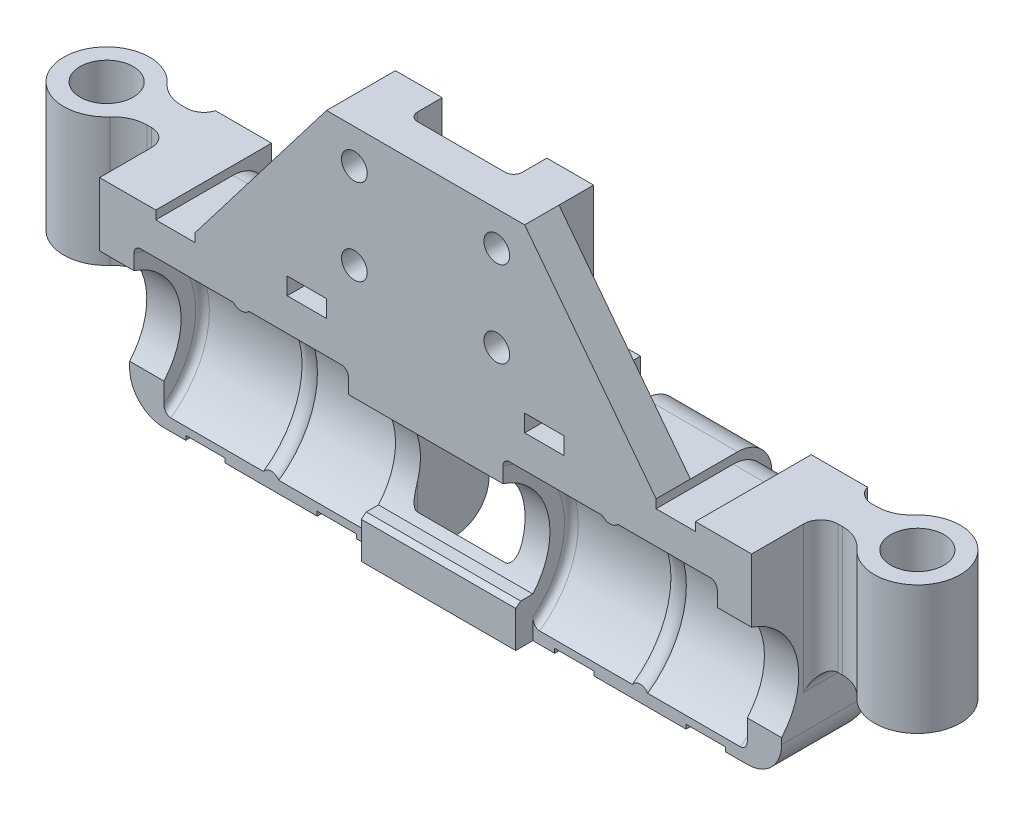
from build123d import *

# Parameters (mm, degrees)
BOSS_EXTRUDE1_DEPTH = 38
CUT_EXTRUDE1_DEPTH  = 38
SKETCH11_W          = 4.582575694955825
SKETCH11_H          = 0.9999999999999964
SKETCH11_W_2        = 4.582575694955834
CUT_EXTRUDE2_DEPTH  = 30
SKETCH13_W          = 4.582575694955825
SKETCH13_H          = 0.9999999999999964
SKETCH13_W_2        = 4.582575694955834
CUT_EXTRUDE3_DEPTH  = 30
FILLET1_R           = 4
CUT_EXTRUDE4_DEPTH  = 40
BOSS_EXTRUDE2_DEPTH = 20
BOSS_EXTRUDE4_DEPTH = 3.9999999999999964
FILLET3_R           = 4
SKETCH19_W          = 18.000000000000004
SKETCH19_H          = 4.708497377870816
BOSS_EXTRUDE5_DEPTH = 2
SKETCH20_R          = 7
CUT_EXTRUDE5_DEPTH  = 11
SKETCH22_R          = 3.1000000000000165
BOSS_EXTRUDE6_DEPTH = 15
FILLET4_R           = 2
SKETCH23_R          = 1.5
CUT_EXTRUDE6_DEPTH  = 10


with BuildPart() as part:
    # Sketch5 → Boss-Extrude1 (new body)
    with BuildSketch(Plane(origin=(0, 0, 0), x_dir=(0, 0, -1), z_dir=(1, 0, 0))):
        with BuildLine():
            Line((2.5000000000000004, 18.500000000000007), (16, 18.500000000000007))
            Line((16, 18.500000000000007), (16, -10))
            Line((16, -10), (5.999999999999997, -10))
            Line((5.999999999999997, -10), (5.9999999999999964, -5.291502622129185))
            ThreePointArc((5.9999999999999964, -5.291502622129185), (7.7204902216687685, 2.096194346218137), (2.5000000000000004, 7.59934207678533))
            Line((2.5000000000000004, 7.59934207678533), (2.5000000000000004, 18.500000000000007))
        make_face()
    extrude(amount=BOSS_EXTRUDE1_DEPTH)

    # Sketch2 → Cut-Revolve1 (revolve, cut)
    with BuildSketch(Plane.XY):
        with BuildLine():
            Line((22.394427190999902, 10.500000000000009), (33.19999999999998, 10.500000000000012))
            ThreePointArc((33.19999999999998, 10.500000000000012), (33.765685424949226, 10.265685424949249), (33.999999999999986, 9.700000000000005))
            Line((33.999999999999986, 9.700000000000005), (33.999999999999986, 0))
            Line((33.999999999999986, 0), (9, 0))
            Line((9, 0), (9, 9.699999999999998))
            ThreePointArc((9, 9.699999999999998), (9.234314575050757, 10.265685424949243), (9.8, 10.500000000000009))
            Line((9.8, 10.500000000000009), (20.6055728090001, 10.500000000000009))
            ThreePointArc((20.6055728090001, 10.500000000000009), (21.5, 10.100000000000017), (22.394427190999902, 10.500000000000009))
        make_face()
    revolve(axis=Axis((0, 0, 0), (1, 0, 0)), mode=Mode.SUBTRACT)

    # Sketch4 → Cut-Extrude1 (cut)
    with BuildSketch(Plane.XY):
        Polygon((11.549695158147133, 15.000000000000005), (0, 15.000000000000007), (0, 25.000000000000007), (38, 25.000000000000007), (38, 15.000000000000007), (31.450304841852876, 15.000000000000007), (31.450304841852876, 14.000000000000005), (26.867729146897045, 14.000000000000005), (26.867729146897045, 15.000000000000007), (16.132270853102966, 15.000000000000007), (16.132270853102966, 14.000000000000005), (11.549695158147133, 14.000000000000005), align=None)
    extrude(amount=-CUT_EXTRUDE1_DEPTH, mode=Mode.SUBTRACT)

    # Sketch11 → Cut-Extrude2 (cut)
    with BuildSketch(Plane.XY):
        with Locations((29.15901699437496, -10.000000000000002)):
            Rectangle(SKETCH11_W, SKETCH11_H)
        with Locations((13.840983005625056, -10.000000000000002)):
            Rectangle(SKETCH11_W_2, SKETCH11_H)
    extrude(amount=-CUT_EXTRUDE2_DEPTH, mode=Mode.SUBTRACT)

    # Sketch13 → Cut-Extrude3 (cut)
    with BuildSketch(Plane.XZ.offset(10)):
        with Locations((29.15901699437496, -16)):
            Rectangle(SKETCH13_W, SKETCH13_H)
        with Locations((13.840983005625056, -16)):
            Rectangle(SKETCH13_W_2, SKETCH13_H)
    extrude(amount=-CUT_EXTRUDE3_DEPTH, mode=Mode.SUBTRACT)

    # Fillet1
    fillet1_edges = [part.edges().sort_by_distance(p)[0] for p in [
        (29.15901699437496, -9.500000000000004, -15.500000000000004),
        (29.15901699437496, 14.000000000000007, -15.500000000000004),
        (13.840983005625052, 14.000000000000007, -15.500000000000004),
        (13.840983005625056, -9.500000000000004, -15.500000000000004),
    ]]
    fillet(fillet1_edges, radius=FILLET1_R)


with BuildPart() as body_2:
    # Mirror1: mirrored copy
    add(part.part.mirror(Plane(origin=(0, 0, 0), x_dir=(0, 0, 1), z_dir=(1, 0, 0))))


with BuildPart() as cut_extrude4_tool:
    # Sketch14 → Cut-Extrude4 (new body)
    with BuildSketch(Plane.XZ.offset(10)):
        with BuildLine():
            Line((6.099999999999472, -17.67179676972446), (6.099999999999507, -7.671796769724419))
            ThreePointArc((6.099999999999507, -7.671796769724419), (5.8071067811860555, -6.964689988537862), (5.0999999999995, -6.671796769724408))
            Line((5.0999999999995, -6.671796769724408), (-5.1000000000004855, -6.671796769724408))
            ThreePointArc((-5.1000000000004855, -6.671796769724408), (-5.807106781187039, -6.9646899885378595), (-6.100000000000493, -7.671796769724412))
            Line((-6.100000000000493, -7.671796769724412), (-6.100000000000527, -17.671796769724402))
            ThreePointArc((-6.100000000000527, -17.671796769724402), (-5.807106781187075, -18.378903550910955), (-5.100000000000525, -18.67179676972441))
            Line((-5.100000000000525, -18.67179676972441), (5.09999999999946, -18.671796769724462))
            ThreePointArc((5.09999999999946, -18.671796769724462), (5.807106781186016, -18.378903550911012), (6.099999999999472, -17.67179676972446))
        make_face()
    extrude(amount=-CUT_EXTRUDE4_DEPTH)


with BuildPart() as part_1:
    add(part.part)

    # Cut-Extrude4: cut by cut_extrude4_tool
    add(cut_extrude4_tool.part, mode=Mode.SUBTRACT)


with BuildPart() as body_2_1:
    add(body_2.part)

    # Cut-Extrude4: cut by cut_extrude4_tool
    add(cut_extrude4_tool.part, mode=Mode.SUBTRACT)


with BuildPart() as part_2:
    add(part_1.part)

    # Combine1: union body 2
    add(body_2_1.part)

    # Sketch15 → Boss-Extrude2 (add)
    with BuildSketch(Plane(origin=(2.25e-15, 15.000000000000007, 0), x_dir=(-1, 1.5e-16, 0), z_dir=(1.5e-16, 1, 0))):
        with BuildLine():
            Line((-6.09999999999949, -8.661985039566389), (-6.099999999999495, -10.534460391340872))
            Line((-6.099999999999495, -10.534460391340872), (-11.549695158147133, -10.534460391340872))
            Line((-11.549695158147133, -10.534460391340872), (-11.54969515814713, -2.5000000000000004))
            Line((-11.54969515814713, -2.5000000000000004), (11.549695158147134, -2.4999999999999996))
            Line((11.549695158147134, -2.4999999999999996), (11.549695158147134, -10.534460391340872))
            Line((11.549695158147134, -10.534460391340872), (6.100000000000504, -10.534460391340872))
            Line((6.100000000000504, -10.534460391340872), (6.100000000000515, -7.671796769724417))
            ThreePointArc((6.100000000000515, -7.671796769724417), (5.807106781187063, -6.964689988537863), (5.100000000000508, -6.67179676972441))
            Line((5.100000000000508, -6.67179676972441), (-5.099999999999483, -6.67179676972441))
            ThreePointArc((-5.099999999999483, -6.67179676972441), (-5.807106781186038, -6.964689988537863), (-6.09999999999949, -7.671796769724417))
            Line((-6.09999999999949, -7.671796769724417), (-6.09999999999949, -8.661985039566389))
        make_face()
    extrude(amount=BOSS_EXTRUDE2_DEPTH)

    # Sketch18 → Boss-Extrude4 (add)
    with BuildSketch(Plane.XY.offset(-2.5000000000000004)):
        Polygon((-16.132270853102966, 15.000000000000007), (-16.132270853102966, 16.000000000000007), (-11.549695158147133, 16.000000000000007), (-11.549695158147129, 35), (-26.867729146897045, 15.000000000000007), align=None)
        Polygon((11.549695158147129, 35), (11.549695158147133, 16.000000000000007), (16.132270853102966, 16.000000000000007), (16.132270853102966, 15.000000000000007), (26.867729146897045, 15.000000000000007), align=None)
    extrude(amount=-BOSS_EXTRUDE4_DEPTH)

    # Fillet3
    fillet3_edges = [part_2.edges().sort_by_distance(p)[0] for p in [
        (38, -10, -10.999999999999998),
        (34.725152420926435, -10, -16),
        (8.824847579073309, -10, -16),
        (-8.82484757907383, -10, -16),
        (-38, -10, -10.999999999999998),
        (-34.725152420926435, -10, -16),
        (-21.500000000000007, -10, -16),
        (-21.500000000000007, 15.000000000000007, -16),
        (21.500000000000007, 15.000000000000007, -16),
        (21.500000000000007, -10, -16),
    ]]
    fillet(fillet3_edges, radius=FILLET3_R)

    # Sketch19 → Boss-Extrude5 (add)
    with BuildSketch(Plane.XY.offset(-5.999999999999996)):
        with Locations((0, -7.645751311064593)):
            Rectangle(SKETCH19_W, SKETCH19_H)
    extrude(amount=BOSS_EXTRUDE5_DEPTH)

    # Sketch20 → Cut-Extrude5 (cut, symmetric)
    with BuildSketch(Plane(origin=(0, 0, 0), x_dir=(0, 0, -1), z_dir=(1, 0, 0))):
        Circle(SKETCH20_R)
    extrude(amount=CUT_EXTRUDE5_DEPTH, both=True, mode=Mode.SUBTRACT)

    # Sketch22 → Boss-Extrude6 (add)
    # profile 1 of 2: a face of its own
    with BuildSketch(Plane.XZ):
        with BuildLine():
            Line((38, -14.571796769727284), (38, -10.571796769726053))
            Line((38, -10.571796769726053), (40.54179606749194, -10.57179676972605))
            ThreePointArc((40.54179606749194, -10.57179676972605), (42.17478922934772, -10.223280486427011), (43.52322003749214, -9.238463436392182))
            ThreePointArc((43.52322003749214, -9.238463436392182), (52.24999999999238, -12.571796769723484), (43.52322003749396, -15.90513010305953))
            ThreePointArc((43.52322003749396, -15.90513010305953), (42.17478922934999, -14.920313053025879), (40.5417960674952, -14.571796769727282))
            Line((40.5417960674952, -14.571796769727282), (38, -14.571796769727284))
        make_face()
        with Locations(Location((47.24999999999238, -12.571796769724845, 0), (0, 0, 270))):
            Circle(SKETCH22_R, mode=Mode.SUBTRACT)
    # profile 2 of 2: a face of its own
    with BuildSketch(Plane.XZ):
        with BuildLine():
            Line((-40.5417960674952, -14.571796769727282), (-38, -14.571796769727284))
            Line((-38, -14.571796769727284), (-38, -10.571796769726053))
            Line((-38, -10.571796769726053), (-40.54179606749194, -10.57179676972605))
            ThreePointArc((-40.54179606749194, -10.57179676972605), (-42.17478922934772, -10.223280486427011), (-43.52322003749214, -9.238463436392182))
            ThreePointArc((-43.52322003749214, -9.238463436392182), (-52.24999999999238, -12.571796769723486), (-43.52322003749396, -15.90513010305953))
            ThreePointArc((-43.52322003749396, -15.90513010305953), (-42.17478922934999, -14.920313053025879), (-40.5417960674952, -14.571796769727282))
        make_face()
        with Locations(Location((-47.24999999999238, -12.571796769724845, 0), (0, 0, 90))):
            Circle(SKETCH22_R, mode=Mode.SUBTRACT)
    extrude(amount=-BOSS_EXTRUDE6_DEPTH)

    # Fillet4
    # the kernel refuses this fillet: 2 mm, written as the material it adds along each edge
    with BuildSketch(Plane(origin=(-38, 0, -10.571796769726053), x_dir=(0, 0, 1), z_dir=(0, 1, 0))) as fillet4_piece_1:
        with BuildLine():
            CenterArc((FILLET4_R, -FILLET4_R), FILLET4_R, 90, 90)
            Line((1.78e-15, -FILLET4_R), (-FILLET4_R * 0.02, -FILLET4_R))
            Line((-FILLET4_R * 0.02, -FILLET4_R), (-FILLET4_R * 0.02, FILLET4_R * 0.02))
            Line((-FILLET4_R * 0.02, FILLET4_R * 0.02), (FILLET4_R, FILLET4_R * 0.02))
            Line((FILLET4_R, FILLET4_R * 0.02), (FILLET4_R, 0))
        make_face()
    extrude(amount=15)
    with BuildSketch(Plane(origin=(-38, 0, -14.571796769727284), x_dir=(0, 0, -1), z_dir=(0, 1, 0))) as fillet4_piece_2:
        with BuildLine():
            CenterArc((1.9999999999999982, 1.91651988096379), FILLET4_R, 180, 73.38744315586348)
            Line((-1.78e-15, 1.91651988096379), (-0.04000000000000092, 1.91651988096379))
            Line((-0.04000000000000092, 1.91651988096379), (-0.03999999999999915, 0))
            Line((-0.03999999999999915, 0), (0, -0.03999999999999915))
            ThreePointArc((0, -0.03999999999999915), (0.7141016151363591, -0.03999999999999915), (1.41676729487817, -0.03833039761927637))
            Line((1.41676729487817, -0.03833039761927637), (1.4282032302727163, 0))
        make_face()
    extrude(amount=15)
    with BuildSketch(Plane(origin=(-38, 0, -14.571796769727284), x_dir=(0, -1, 0), z_dir=(0, 0, 1))) as fillet4_piece_3:
        with BuildLine():
            CenterArc((FILLET4_R, -FILLET4_R), FILLET4_R, 90, 90)
            Line((0, -FILLET4_R), (-FILLET4_R * 0.02, -FILLET4_R))
            Line((-FILLET4_R * 0.02, -FILLET4_R), (-FILLET4_R * 0.02, FILLET4_R * 0.02))
            Line((-FILLET4_R * 0.02, FILLET4_R * 0.02), (FILLET4_R, FILLET4_R * 0.02))
            Line((FILLET4_R, FILLET4_R * 0.02), (FILLET4_R, 0))
        make_face()
    extrude(amount=4.000000000001231)
    with BuildSketch(Plane(origin=(38, 0, -14.571796769727284), x_dir=(0, 0, -1), z_dir=(0, 1, 0))) as fillet4_piece_4:
        with BuildLine():
            CenterArc((1.9999999999999982, -1.91651988096379), FILLET4_R, 106.61255684413655, 73.38744315586345)
            Line((-1.78e-15, -1.91651988096379), (-0.04000000000000092, -1.91651988096379))
            Line((-0.04000000000000092, -1.91651988096379), (-0.03999999999999915, 0))
            Line((-0.03999999999999915, 0), (0, 0.03999999999999915))
            ThreePointArc((0, 0.03999999999999915), (0.7141016151363591, 0.03999999999999915), (1.41676729487817, 0.03833039761927637))
            Line((1.41676729487817, 0.03833039761927637), (1.4282032302727163, 0))
        make_face()
    extrude(amount=15)
    with BuildSketch(Plane(origin=(38, 0, -10.571796769726053), x_dir=(0, 0, 1), z_dir=(0, 1, 0))) as fillet4_piece_5:
        with BuildLine():
            CenterArc((FILLET4_R, FILLET4_R), FILLET4_R, 180, 90)
            Line((1.78e-15, FILLET4_R), (-FILLET4_R * 0.02, FILLET4_R))
            Line((-FILLET4_R * 0.02, FILLET4_R), (-FILLET4_R * 0.02, -FILLET4_R * 0.02))
            Line((-FILLET4_R * 0.02, -FILLET4_R * 0.02), (FILLET4_R, -FILLET4_R * 0.02))
            Line((FILLET4_R, -FILLET4_R * 0.02), (FILLET4_R, 0))
        make_face()
    extrude(amount=15)
    with BuildSketch(Plane(origin=(38, 0, -14.571796769727284), x_dir=(0, -1, 0), z_dir=(0, 0, 1))) as fillet4_piece_6:
        with BuildLine():
            CenterArc((FILLET4_R, FILLET4_R), FILLET4_R, 180, 90)
            Line((0, FILLET4_R), (-FILLET4_R * 0.02, FILLET4_R))
            Line((-FILLET4_R * 0.02, FILLET4_R), (-FILLET4_R * 0.02, -FILLET4_R * 0.02))
            Line((-FILLET4_R * 0.02, -FILLET4_R * 0.02), (FILLET4_R, -FILLET4_R * 0.02))
            Line((FILLET4_R, -FILLET4_R * 0.02), (FILLET4_R, 0))
        make_face()
    extrude(amount=4.000000000001231)
    with BuildSketch(Plane(origin=(-38, 0, -14.571796769727284), x_dir=(0, -1, 0), z_dir=(0, 0, 1))) as fillet4_piece_7a_section:
        with BuildLine():
            CenterArc((FILLET4_R, -FILLET4_R), FILLET4_R, 90, 90)
            Line((0, -FILLET4_R), (-FILLET4_R * 0.02, -FILLET4_R))
            Line((-FILLET4_R * 0.02, -FILLET4_R), (-FILLET4_R * 0.02, FILLET4_R * 0.02))
            Line((-FILLET4_R * 0.02, FILLET4_R * 0.02), (FILLET4_R, FILLET4_R * 0.02))
            Line((FILLET4_R, FILLET4_R * 0.02), (FILLET4_R, 0))
        make_face()
    fillet4_piece_7a = extrude(amount=9.000000000001231, mode=Mode.PRIVATE)
    fillet4_piece_7a = fillet4_piece_7a - Plane(origin=(-38.44965447963758, -2.33e-15, 4.44e-15), x_dir=(0, -0.6614378277661477, -0.75), z_dir=(1, 0, 0)) * Cylinder(8.000000000000002, 27, mode=Mode.PRIVATE)
    fillet4_piece_7a = split(fillet4_piece_7a, bisect_by=Plane(origin=(-38.44965447963758, -0.4590630115931707, -10.571796769726053), z_dir=(7e-16, 0, 1)), keep=Keep.TOP, mode=Mode.PRIVATE)
    with BuildSketch(Plane(origin=(-38, -5.0000000000000036, -10.571796769726053), x_dir=(0, 0, 1), z_dir=(0, 1, 0))) as fillet4_piece_7b_section:
        with BuildLine():
            CenterArc((FILLET4_R, -FILLET4_R), FILLET4_R, 90, 90)
            Line((1.78e-15, -FILLET4_R), (-FILLET4_R * 0.02, -FILLET4_R))
            Line((-FILLET4_R * 0.02, -FILLET4_R), (-FILLET4_R * 0.02, FILLET4_R * 0.02))
            Line((-FILLET4_R * 0.02, FILLET4_R * 0.02), (FILLET4_R, FILLET4_R * 0.02))
            Line((FILLET4_R, FILLET4_R * 0.02), (FILLET4_R, 0))
        make_face()
    fillet4_piece_7b = extrude(amount=20.000000000000004, mode=Mode.PRIVATE)
    fillet4_piece_7b = split(fillet4_piece_7b, bisect_by=Plane(origin=(-38.45279022853365, 0, -10.1190065411924), z_dir=(0, -1, 0)), keep=Keep.TOP, mode=Mode.PRIVATE)
    fillet4_piece_7 = fillet4_piece_7a & fillet4_piece_7b
    add(fillet4_piece_7)
    with BuildSketch(Plane(origin=(-38, -4.791299702409475, -14.571796769727284), x_dir=(0, 0, -1), z_dir=(0, 1, 0))) as fillet4_piece_8a_section:
        with BuildLine():
            CenterArc((1.9999999999999982, 1.91651988096379), FILLET4_R, 180, 73.38744315586348)
            Line((-1.78e-15, 1.91651988096379), (-0.04000000000000092, 1.91651988096379))
            Line((-0.04000000000000092, 1.91651988096379), (-0.03999999999999915, 0))
            Line((-0.03999999999999915, 0), (0, -0.03999999999999915))
            ThreePointArc((0, -0.03999999999999915), (0.7141016151363591, -0.03999999999999915), (1.41676729487817, -0.03833039761927637))
            Line((1.41676729487817, -0.03833039761927637), (1.4282032302727163, 0))
        make_face()
    fillet4_piece_8a = extrude(amount=19.791299702409475, mode=Mode.PRIVATE)
    fillet4_piece_8a = split(fillet4_piece_8a, bisect_by=Plane(origin=(-38.45493974917417, 0, -14.935611053245069), z_dir=(0, -1, 0)), keep=Keep.TOP, mode=Mode.PRIVATE)
    with BuildSketch(Plane(origin=(-38, 0, -19.571796769727285), x_dir=(0, -1, 0), z_dir=(0, 0, 1))) as fillet4_piece_8b_section:
        with BuildLine():
            CenterArc((FILLET4_R, -FILLET4_R), FILLET4_R, 90, 90)
            Line((0, -FILLET4_R), (-FILLET4_R * 0.02, -FILLET4_R))
            Line((-FILLET4_R * 0.02, -FILLET4_R), (-FILLET4_R * 0.02, FILLET4_R * 0.02))
            Line((-FILLET4_R * 0.02, FILLET4_R * 0.02), (FILLET4_R, FILLET4_R * 0.02))
            Line((FILLET4_R, FILLET4_R * 0.02), (FILLET4_R, 0))
        make_face()
    fillet4_piece_8b = extrude(amount=9.000000000001233, mode=Mode.PRIVATE)
    fillet4_piece_8b = split(fillet4_piece_8b, bisect_by=Plane(origin=(-38.45279022853366, -0.4527902285336509, -16), z_dir=(0, 0, 1)), keep=Keep.TOP, mode=Mode.PRIVATE)
    fillet4_piece_8b = split(fillet4_piece_8b, bisect_by=Plane(origin=(-38.45279022853365, -0.4527902285336494, -14.571796769727284), z_dir=(-7e-16, 0, -1)), keep=Keep.TOP, mode=Mode.PRIVATE)
    fillet4_piece_8 = fillet4_piece_8a & fillet4_piece_8b
    add(fillet4_piece_8)
    with BuildSketch(Plane(origin=(38, -4.791299702409475, -14.571796769727284), x_dir=(0, 0, -1), z_dir=(0, 1, 0))) as fillet4_piece_9a_section:
        with BuildLine():
            CenterArc((1.9999999999999982, -1.91651988096379), FILLET4_R, 106.61255684413655, 73.38744315586345)
            Line((-1.78e-15, -1.91651988096379), (-0.04000000000000092, -1.91651988096379))
            Line((-0.04000000000000092, -1.91651988096379), (-0.03999999999999915, 0))
            Line((-0.03999999999999915, 0), (0, 0.03999999999999915))
            ThreePointArc((0, 0.03999999999999915), (0.7141016151363591, 0.03999999999999915), (1.41676729487817, 0.03833039761927637))
            Line((1.41676729487817, 0.03833039761927637), (1.4282032302727163, 0))
        make_face()
    fillet4_piece_9a = extrude(amount=19.791299702409475, mode=Mode.PRIVATE)
    fillet4_piece_9a = split(fillet4_piece_9a, bisect_by=Plane(origin=(38.454939749174166, 0, -14.935611053245067), z_dir=(0, -1, 0)), keep=Keep.TOP, mode=Mode.PRIVATE)
    with BuildSketch(Plane(origin=(38, 0, -19.571796769727285), x_dir=(0, -1, 0), z_dir=(0, 0, 1))) as fillet4_piece_9b_section:
        with BuildLine():
            CenterArc((FILLET4_R, FILLET4_R), FILLET4_R, 180, 90)
            Line((0, FILLET4_R), (-FILLET4_R * 0.02, FILLET4_R))
            Line((-FILLET4_R * 0.02, FILLET4_R), (-FILLET4_R * 0.02, -FILLET4_R * 0.02))
            Line((-FILLET4_R * 0.02, -FILLET4_R * 0.02), (FILLET4_R, -FILLET4_R * 0.02))
            Line((FILLET4_R, -FILLET4_R * 0.02), (FILLET4_R, 0))
        make_face()
    fillet4_piece_9b = extrude(amount=9.000000000001233, mode=Mode.PRIVATE)
    fillet4_piece_9b = split(fillet4_piece_9b, bisect_by=Plane(origin=(38.45279022853365, -0.4527902285336509, -16), z_dir=(0, 0, 1)), keep=Keep.TOP, mode=Mode.PRIVATE)
    fillet4_piece_9b = split(fillet4_piece_9b, bisect_by=Plane(origin=(38.452790228533644, -0.4527902285336494, -14.571796769727284), z_dir=(7e-16, 0, -1)), keep=Keep.TOP, mode=Mode.PRIVATE)
    fillet4_piece_9 = fillet4_piece_9a & fillet4_piece_9b
    add(fillet4_piece_9)
    with BuildSketch(Plane(origin=(38, 0, -14.571796769727284), x_dir=(0, -1, 0), z_dir=(0, 0, 1))) as fillet4_piece_10a_section:
        with BuildLine():
            CenterArc((FILLET4_R, FILLET4_R), FILLET4_R, 180, 90)
            Line((0, FILLET4_R), (-FILLET4_R * 0.02, FILLET4_R))
            Line((-FILLET4_R * 0.02, FILLET4_R), (-FILLET4_R * 0.02, -FILLET4_R * 0.02))
            Line((-FILLET4_R * 0.02, -FILLET4_R * 0.02), (FILLET4_R, -FILLET4_R * 0.02))
            Line((FILLET4_R, -FILLET4_R * 0.02), (FILLET4_R, 0))
        make_face()
    fillet4_piece_10a = extrude(amount=9.000000000001231, mode=Mode.PRIVATE)
    fillet4_piece_10a = fillet4_piece_10a - Plane(origin=(38.44965447963757, -2.33e-15, 4.44e-15), x_dir=(0, -0.6614378277661477, -0.75), z_dir=(-1, 0, 0)) * Cylinder(8.000000000000002, 27, mode=Mode.PRIVATE)
    fillet4_piece_10a = split(fillet4_piece_10a, bisect_by=Plane(origin=(38.44965447963757, -0.4590630115931711, -10.571796769726053), z_dir=(-7e-16, 0, 1)), keep=Keep.TOP, mode=Mode.PRIVATE)
    with BuildSketch(Plane(origin=(38, -5.0000000000000036, -10.571796769726053), x_dir=(0, 0, 1), z_dir=(0, 1, 0))) as fillet4_piece_10b_section:
        with BuildLine():
            CenterArc((FILLET4_R, FILLET4_R), FILLET4_R, 180, 90)
            Line((1.78e-15, FILLET4_R), (-FILLET4_R * 0.02, FILLET4_R))
            Line((-FILLET4_R * 0.02, FILLET4_R), (-FILLET4_R * 0.02, -FILLET4_R * 0.02))
            Line((-FILLET4_R * 0.02, -FILLET4_R * 0.02), (FILLET4_R, -FILLET4_R * 0.02))
            Line((FILLET4_R, -FILLET4_R * 0.02), (FILLET4_R, 0))
        make_face()
    fillet4_piece_10b = extrude(amount=20.000000000000004, mode=Mode.PRIVATE)
    fillet4_piece_10b = split(fillet4_piece_10b, bisect_by=Plane(origin=(38.45279022853365, 0, -10.119006541192402), z_dir=(0, -1, 0)), keep=Keep.TOP, mode=Mode.PRIVATE)
    fillet4_piece_10 = fillet4_piece_10a & fillet4_piece_10b
    add(fillet4_piece_10)

    # Sketch23 → Cut-Extrude6 (cut)
    with BuildSketch(Plane.XY.offset(-2.5000000000000004)):
        with Locations((8.29999999999877, 21.000000000000004)):
            Circle(SKETCH23_R)
        with Locations((-8.29999999999877, 31.000000000000007)):
            Circle(SKETCH23_R)
        with Locations((8.29999999999877, 31.000000000000007)):
            Circle(SKETCH23_R)
        with Locations((-8.29999999999877, 21.000000000000004)):
            Circle(SKETCH23_R)
    extrude(amount=-CUT_EXTRUDE6_DEPTH, mode=Mode.SUBTRACT)


solid = part_2.part
